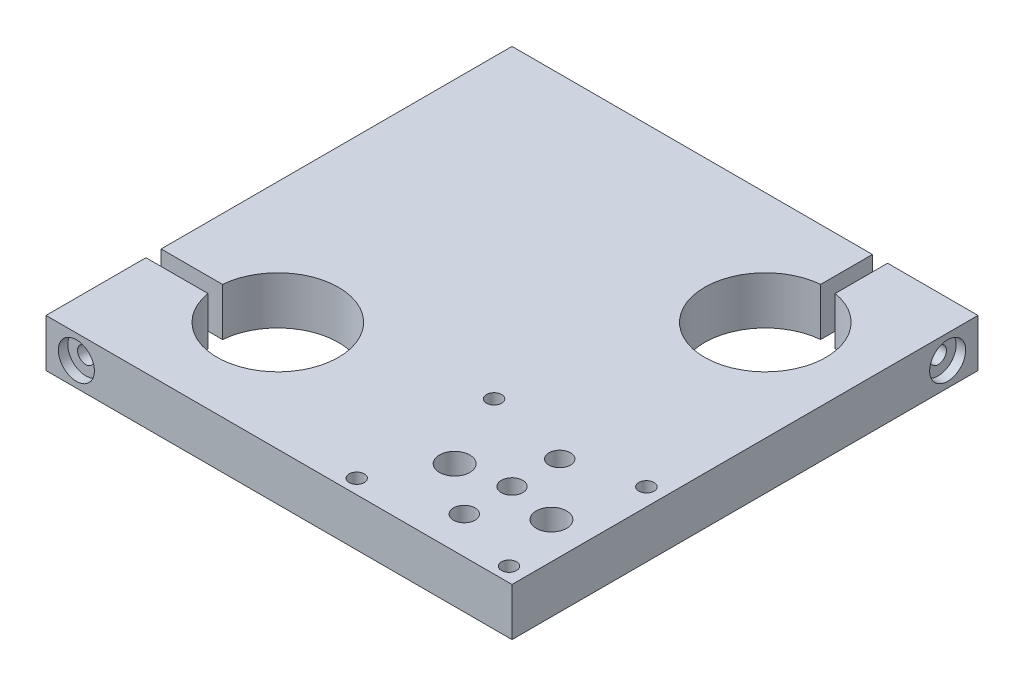
from build123d import *

# Parameters (mm, degrees)
SKETCH1_W                                           = 97.5
SKETCH1_H                                           = 97.5
BOSS_EXTRUDE1_DEPTH                                 = 10
CUT_EXTRUDE4_REACH                                  = 71.664
SKETCH14_R                                          = 12.7
CUT_EXTRUDE5_REACH                                  = 111.466
CUT_EXTRUDE5_END_RADIUS                             = 12.7
SKETCH15_W                                          = 3.175
SKETCH15_H                                          = 10
CUT_EXTRUDE6_REACH                                  = 111.466
CUT_EXTRUDE6_END_RADIUS                             = 12.7
SKETCH16_W                                          = 3.175
SKETCH16_H                                          = 10
CBORE_START                                         = 27.8375
CBORE_FOR_5_BINDING_HEAD_MACHINE_SC_2_R             = 1.7272
CBORE_FOR_5_BINDING_HEAD_MACHINE_SCREW2_DEPTH       = 20.9125
CBORE_START_2                                       = 46.7688
CBORE_FOR_5_BINDING_HEAD_MACHINE_SC_3_O_R           = 3.77063
CBORE_FOR_5_BINDING_HEAD_MACHINE_SC_3_O_R_2         = 1.7272
CBORE_FOR_5_BINDING_HEAD_MACHINE_SC_3_DEPTH         = 1.9812
CBORE_FOR_5_BINDING_HEAD_MACHINE_SCREW3_D           = 3.4544
CBORE_FOR_5_BINDING_HEAD_MACHINE_SCREW3_DEPTH       = 22.0865
CBORE_FOR_5_BINDING_HEAD_MACHINE_SCREW3_CBORE_D     = 7.54126
CBORE_FOR_5_BINDING_HEAD_MACHINE_SCREW3_CBORE_DEPTH = 1.9812
F_1_8_0_125_DIAMETER_HOLE2_D                        = 3.175
CBORE_FOR_8_BINDING_HEAD_MACHINE_SCREW1_D           = 4.4958
CBORE_FOR_8_BINDING_HEAD_MACHINE_SCREW1_CBORE_D     = 9.525
CBORE_FOR_8_BINDING_HEAD_MACHINE_SCREW1_CBORE_DEPTH = 2.667
F_1_4_0_25_DIAMETER_HOLE2_D                         = 6.35


# Read off the part's stored shape, not the designer's step: CBORE for #5 Binding Head Machine Screw2
with BuildPart() as part:
    # Sketch1 → Boss-Extrude1 (new body)
    with BuildSketch(Plane(origin=(0, 0, 0), x_dir=(1, 0, 0), z_dir=(0, 1, 0))):
        Rectangle(SKETCH1_W, SKETCH1_H)
    extrude(amount=BOSS_EXTRUDE1_DEPTH)

    # Sketch14 → Cut-Extrude4 (cut, up to next)
    with BuildSketch(Plane(origin=(0, 10, 0), x_dir=(1, 0, 0), z_dir=(0, 1, 0)), mode=Mode.PRIVATE) as cut_extrude4_sk1:
        with Locations(Location((-23.25, -25.75, 0), (0, 0, 270))):
            Circle(SKETCH14_R)
    cut_extrude4_tool1 = extrude(cut_extrude4_sk1.sketch, amount=-CUT_EXTRUDE4_REACH, mode=Mode.PRIVATE) & part.part
    # Sketch14 → Cut-Extrude4 (cut, up to next)
    with BuildSketch(Plane(origin=(0, 10, 0), x_dir=(1, 0, 0), z_dir=(0, 1, 0)), mode=Mode.PRIVATE) as cut_extrude4_sk2:
        with Locations(Location((27.75, 25.25, 0), (0, 0, 270))):
            Circle(SKETCH14_R)
    cut_extrude4_tool2 = extrude(cut_extrude4_sk2.sketch, amount=-CUT_EXTRUDE4_REACH, mode=Mode.PRIVATE) & part.part
    add(cut_extrude4_tool1.solids().sort_by_distance((-23.25, 10, 25.75))[0], mode=Mode.SUBTRACT)
    add(cut_extrude4_tool2.solids().sort_by_distance((27.75, 10, -25.25))[0], mode=Mode.SUBTRACT)

    # Cut-Extrude5: up to this cylinder (the profile starts outside it)
    cut_extrude5_end = Plane(origin=(-23.25, 5, 25.75), z_dir=(0, 1, 0)) * Cylinder(CUT_EXTRUDE5_END_RADIUS, 249.332, mode=Mode.PRIVATE)
    # Sketch15 → Cut-Extrude5 (cut, up to the surface)
    with BuildSketch(Plane.ZY.offset(48.75), mode=Mode.PRIVATE) as cut_extrude5_sk1:
        with Locations((26.25, 5)):
            Rectangle(SKETCH15_W, SKETCH15_H)
    cut_extrude5_tool1 = extrude(cut_extrude5_sk1.sketch, amount=-CUT_EXTRUDE5_REACH, mode=Mode.PRIVATE) - cut_extrude5_end
    add(cut_extrude5_tool1.solids().sort_by_distance((-48.75, 5, 26.25))[0], mode=Mode.SUBTRACT)

    # Cut-Extrude6: up to this cylinder (the profile starts outside it)
    cut_extrude6_end = Plane(origin=(27.75, 5, -25.25), z_dir=(0, 1, 0)) * Cylinder(CUT_EXTRUDE6_END_RADIUS, 249.332, mode=Mode.PRIVATE)
    # Sketch16 → Cut-Extrude6 (cut, up to the surface)
    with BuildSketch(Plane(origin=(0, 0, -48.75), x_dir=(-1, 0, 0), z_dir=(0, 0, -1)), mode=Mode.PRIVATE) as cut_extrude6_sk1:
        with Locations((-28.25, 5)):
            Rectangle(SKETCH16_W, SKETCH16_H)
    cut_extrude6_tool1 = extrude(cut_extrude6_sk1.sketch, amount=-CUT_EXTRUDE6_REACH, mode=Mode.PRIVATE) - cut_extrude6_end
    add(cut_extrude6_tool1.solids().sort_by_distance((28.25, 5, -48.75))[0], mode=Mode.SUBTRACT)

    # CBORE for _5 Binding Head Machine Sc 2 → CBORE for #5 Binding Head Machine Screw2 (cut)
    with BuildSketch(Plane.XY.offset(CBORE_START)):
        with Locations((-42.4, 5)):
            Circle(CBORE_FOR_5_BINDING_HEAD_MACHINE_SC_2_R)
    extrude(amount=CBORE_FOR_5_BINDING_HEAD_MACHINE_SCREW2_DEPTH, mode=Mode.SUBTRACT)

    # CBORE for _5 Binding Head Machine Sc 3 o → CBORE for _5 Binding Head Machine Sc 3 (cut)
    with BuildSketch(Plane.XY.offset(CBORE_START_2)):
        with Locations((-42.4, 5)):
            Circle(CBORE_FOR_5_BINDING_HEAD_MACHINE_SC_3_O_R)
        with Locations((-42.4, 5)):
            Circle(CBORE_FOR_5_BINDING_HEAD_MACHINE_SC_3_O_R_2, mode=Mode.SUBTRACT)
    extrude(amount=CBORE_FOR_5_BINDING_HEAD_MACHINE_SC_3_DEPTH, mode=Mode.SUBTRACT)

    # CBORE for #5 Binding Head Machine Screw3
    with Locations(Plane(origin=(48.75, 0, 0), x_dir=(0, 0, -1), z_dir=(1, 0, 0))):
        with Locations((42.4, 5)):
            CounterBoreHole(CBORE_FOR_5_BINDING_HEAD_MACHINE_SCREW3_D / 2, CBORE_FOR_5_BINDING_HEAD_MACHINE_SCREW3_CBORE_D / 2, CBORE_FOR_5_BINDING_HEAD_MACHINE_SCREW3_CBORE_DEPTH, depth=CBORE_FOR_5_BINDING_HEAD_MACHINE_SCREW3_DEPTH)

    # 1/8 (0.125) Diameter Hole2 (through all)
    with Locations(Plane(origin=(0, 0, 0), x_dir=(-1, 0, 0), z_dir=(0, -1, 0))):
        with Locations((-13.25, -45.75), (-45.12, -45.75), (-13.25, -17), (-45.12, -17)):
            Hole(F_1_8_0_125_DIAMETER_HOLE2_D / 2)

    # CBORE for #8 Binding Head Machine Screw1 (through all)
    with Locations(Plane(origin=(0, 0, 0), x_dir=(-1, 0, 0), z_dir=(0, -1, 0))):
        with Locations((-31, -40.98776), (-31, -21.01224), (-31, -30.997066185)):
            CounterBoreHole(CBORE_FOR_8_BINDING_HEAD_MACHINE_SCREW1_D / 2, CBORE_FOR_8_BINDING_HEAD_MACHINE_SCREW1_CBORE_D / 2, CBORE_FOR_8_BINDING_HEAD_MACHINE_SCREW1_CBORE_DEPTH)

    # 1/4 (0.25) Diameter Hole2 (through all)
    with Locations(Plane(origin=(0, 0, 0), x_dir=(-1, 0, 0), z_dir=(0, -1, 0))):
        with Locations((-20.87, -32.875), (-41.13, -32.875)):
            Hole(F_1_4_0_25_DIAMETER_HOLE2_D / 2)


solid = part.part
